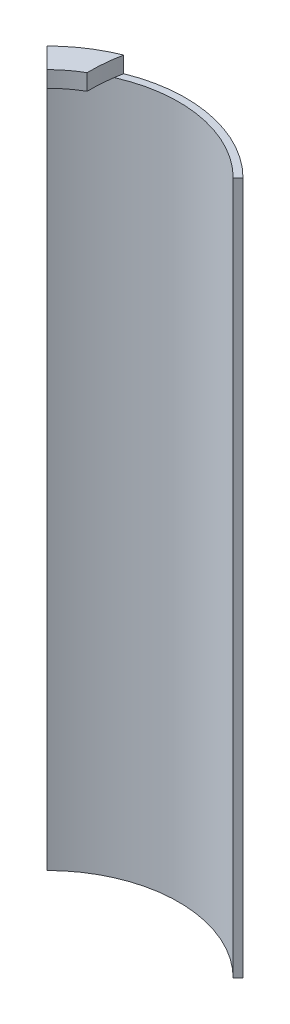
from build123d import *

# Parameters (mm, degrees)
SKETCH1_W           = 3
SKETCH1_H           = 300
SKETCH6_OUTSIDE_W   = 190.934
SKETCH6_OUTSIDE_H   = 190.934
CUT_EXTRUDE2_DEPTH  = 312.769145362
BOSS_EXTRUDE4_DEPTH = 7


with BuildPart() as part:
    # Sketch1 → Revolve1 (revolve)
    with BuildSketch(Plane.XY):
        with Locations((58.5, 0)):
            Rectangle(SKETCH1_W, SKETCH1_H)
    revolve(axis=Axis((0, 0, 0), (0, 1, 0)))

    # Sketch6 outside → Cut-Extrude2 (cut, through all)
    with BuildSketch(Plane(origin=(0, 150, 0), x_dir=(1, 0, 0), z_dir=(0, 1, 0))):
        Rectangle(SKETCH6_OUTSIDE_W, SKETCH6_OUTSIDE_H)
        with BuildLine():
            Line((0, 0), (-42.426406871, 42.426406871))
            ThreePointArc((-42.426406871, 42.426406871), (0, 60), (42.426406871, 42.426406871))
            Line((42.426406871, 42.426406871), (0, 0))
        make_face(mode=Mode.SUBTRACT)
    extrude(amount=-CUT_EXTRUDE2_DEPTH, mode=Mode.SUBTRACT)

    # Sketch7 → Boss-Extrude4 (add)
    with BuildSketch(Plane(origin=(0, 150, 0), x_dir=(1, 0, 0), z_dir=(0, 1, 0))):
        with BuildLine():
            ThreePointArc((-33.587572106, 33.587572106), (-28.916167878, 37.684283664), (-23.75, 41.13620668))
            ThreePointArc((-23.75, 41.13620668), (-23.489751614, 48.429863661), (-22.428076684, 55.650528984))
            ThreePointArc((-22.428076684, 55.650528984), (-33.094491396, 50.047523808), (-42.426406871, 42.426406871))
            Line((-42.426406871, 42.426406871), (-33.587572106, 33.587572106))
        make_face()
    extrude(amount=BOSS_EXTRUDE4_DEPTH)


solid = part.part
